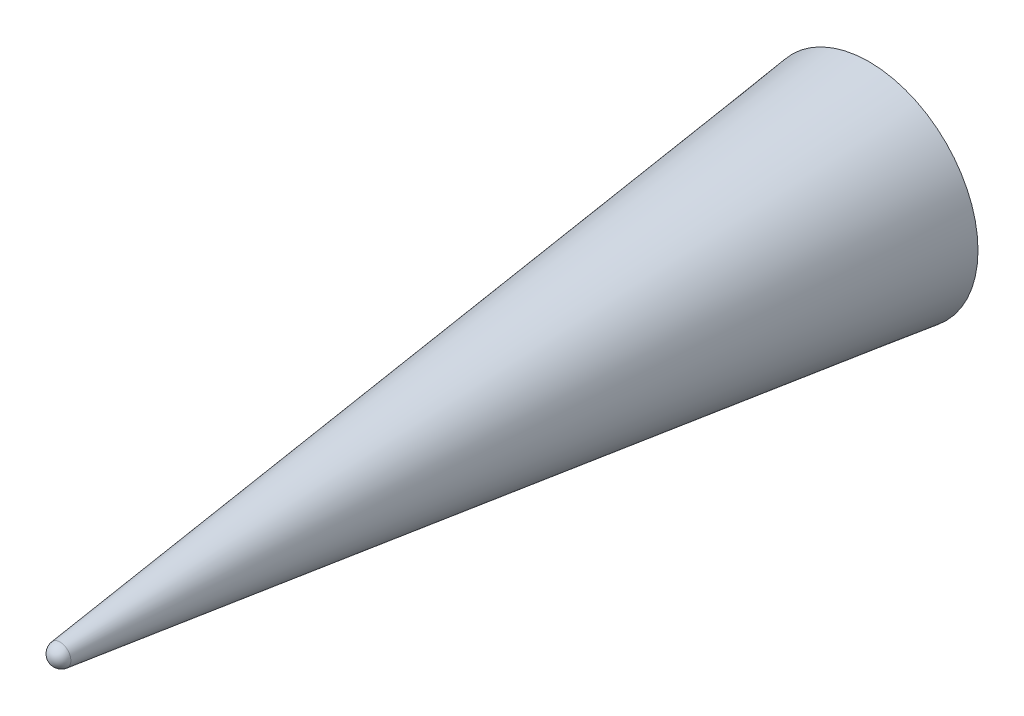
from build123d import *


with BuildPart() as part:
    # Sketch1 → Revolve1 (revolve)
    with BuildSketch(Plane(origin=(0, 0, 0), x_dir=(0, 0, -1), z_dir=(1, 0, 0))):
        with BuildLine():
            Line((-381.963243848, 0), (0, 0))
            Line((0, 0), (0, 50.8))
            Line((0, 50.8), (-377.494527195, 5.043087613))
            ThreePointArc((-377.494527195, 5.043087613), (-380.685330078, 3.369056292), (-381.963243848, 0))
        make_face()
    revolve(axis=Axis((0, 0, 477.571752055), (0, 0, -1)))


solid = part.part
